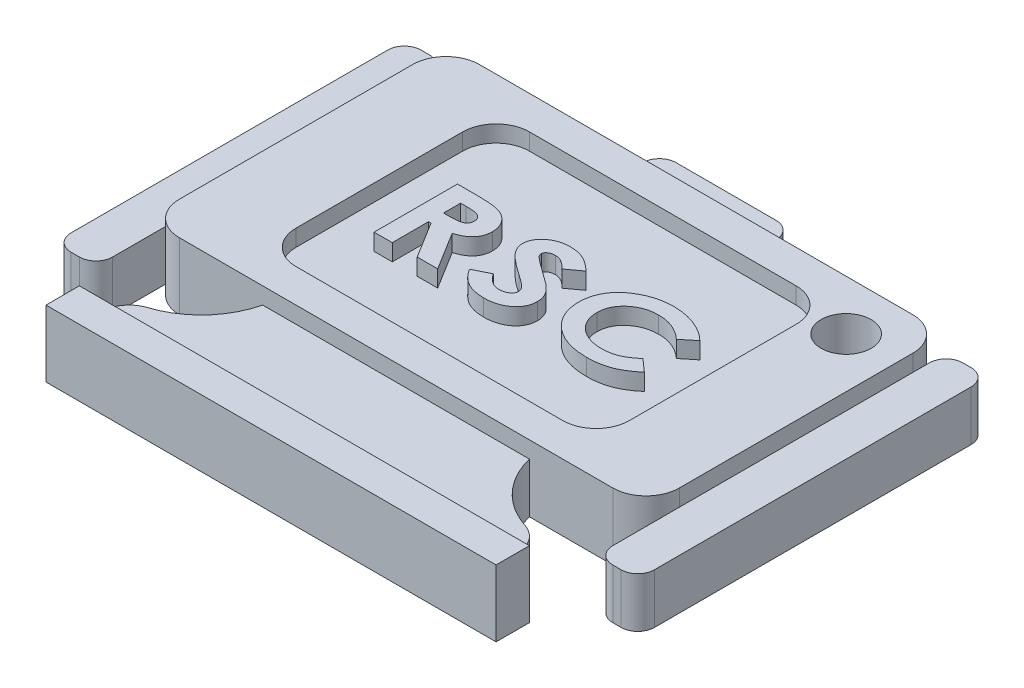
from build123d import *

# Parameters (mm, degrees)
ESTRUSIONE_ESTRUSIONE1_DEPTH = 3
ESTRUSIONE_ESTRUSIONE2_DEPTH = 4
ESTRUSIONE_ESTRUSIONE3_DEPTH = 3
RACCORDO1_R                  = 5
SCHIZZO3_R                   = 1.5
TAGLIO_ESTRUSIONE1_DEPTH     = 25.158579382
ESTRUSIONE_ESTRUSIONE4_DEPTH = 1


with BuildPart() as part:
    # Schizzo1 → Estrusione-Estrusione1 (new body)
    with BuildSketch(Plane(origin=(0, 0, 0), x_dir=(1, 0, 0), z_dir=(0, 1, 0))):
        with BuildLine():
            Line((-14.130087026, -5.671791426), (-14.130087026, 8.328208574))
            Line((-14.130087026, 8.328208574), (-14.130087026, 9.328208574))
            ThreePointArc((-14.130087026, 9.328208574), (-14.422980244, 10.035315355), (-15.130087026, 10.328208574))
            Line((-15.130087026, 10.328208574), (-15.630087026, 10.328208574))
            ThreePointArc((-15.630087026, 10.328208574), (-16.337193807, 10.035315355), (-16.630087026, 9.328208574))
            Line((-16.630087026, 9.328208574), (-16.630087026, -9.671791426))
            ThreePointArc((-16.630087026, -9.671791426), (-16.337193807, -10.378898207), (-15.630087026, -10.671791426))
            Line((-15.630087026, -10.671791426), (-15.130087026, -10.671791426))
            ThreePointArc((-15.130087026, -10.671791426), (-14.422980244, -10.378898207), (-14.130087026, -9.671791426))
            Line((-14.130087026, -9.671791426), (-14.130087026, -5.671791426))
        make_face()
        with BuildLine():
            Line((15.869912974, 9.328208574), (15.869912974, 8.328208574))
            Line((15.869912974, 8.328208574), (15.869912974, -5.671791426))
            Line((15.869912974, -5.671791426), (15.869912974, -9.671791426))
            ThreePointArc((15.869912974, -9.671791426), (16.162806193, -10.378898207), (16.869912974, -10.671791426))
            Line((16.869912974, -10.671791426), (17.369912974, -10.671791426))
            ThreePointArc((17.369912974, -10.671791426), (18.077019756, -10.378898207), (18.369912974, -9.671791426))
            Line((18.369912974, -9.671791426), (18.369912974, 9.328208574))
            ThreePointArc((18.369912974, 9.328208574), (18.077019756, 10.035315355), (17.369912974, 10.328208574))
            Line((17.369912974, 10.328208574), (16.869912974, 10.328208574))
            ThreePointArc((16.869912974, 10.328208574), (16.162806193, 10.035315355), (15.869912974, 9.328208574))
        make_face()
        with BuildLine():
            Line((-3.130087026, 11.128208574), (-3.130087026, 10.328208574))
            Line((-3.130087026, 10.328208574), (4.869912974, 10.328208574))
            Line((4.869912974, 10.328208574), (4.869912974, 11.128208574))
            ThreePointArc((4.869912974, 11.128208574), (4.577019756, 11.835315355), (3.869912974, 12.128208574))
            Line((3.869912974, 12.128208574), (-2.130087026, 12.128208574))
            ThreePointArc((-2.130087026, 12.128208574), (-2.837193807, 11.835315355), (-3.130087026, 11.128208574))
        make_face()
        Polygon((8.869912974, -7.671791426), (-7.130087026, -7.671791426), (-7.130087026, -11.171791426), (-7.130087026, -13.171791426), (8.869912974, -13.171791426), (8.869912974, -11.171791426), align=None)
        with BuildLine():
            Line((11.669912974, -11.171791426), (8.869912974, -11.171791426))
            Line((8.869912974, -11.171791426), (8.869912974, -13.171791426))
            Line((8.869912974, -13.171791426), (12.496589577, -13.171791426))
            Line((12.496589577, -13.171791426), (13.369912974, -13.171791426))
            Line((13.369912974, -13.171791426), (13.369912974, -12.871791426))
            ThreePointArc((13.369912974, -12.871791426), (12.871994503, -11.669709898), (11.669912974, -11.171791426))
        make_face()
        with BuildLine():
            Line((-7.130087026, -13.171791426), (-7.130087026, -11.171791426))
            Line((-7.130087026, -11.171791426), (-9.930087026, -11.171791426))
            ThreePointArc((-9.930087026, -11.171791426), (-11.132168554, -11.669709898), (-11.630087026, -12.871791426))
            Line((-11.630087026, -12.871791426), (-11.630087026, -13.171791426))
            Line((-11.630087026, -13.171791426), (-7.130087026, -13.171791426))
        make_face()
    extrude(amount=ESTRUSIONE_ESTRUSIONE1_DEPTH)

    # Schizzo1<3> → Estrusione-Estrusione2 (add)
    # profile 1 of 2: a face of its own
    with BuildSketch(Plane(origin=(0, 0, 0), x_dir=(1, 0, 0), z_dir=(0, 1, 0))):
        with BuildLine():
            ThreePointArc((13.869912974, 10.328208574), (15.284126537, 9.742422136), (15.869912974, 8.328208574))
            Line((15.869912974, 8.328208574), (15.869912974, -5.671791426))
            ThreePointArc((15.869912974, -5.671791426), (15.284126537, -7.086004989), (13.869912974, -7.671791426))
            Line((13.869912974, -7.671791426), (-12.130087026, -7.671791426))
            ThreePointArc((-12.130087026, -7.671791426), (-13.544300588, -7.086004989), (-14.130087026, -5.671791426))
            Line((-14.130087026, -5.671791426), (-14.130087026, 8.328208574))
            ThreePointArc((-14.130087026, 8.328208574), (-13.544300588, 9.742422136), (-12.130087026, 10.328208574))
            Line((-12.130087026, 10.328208574), (13.869912974, 10.328208574))
        make_face()
        with BuildLine():
            ThreePointArc((-7.130087026, 8.328208574), (-8.544300588, 7.742422136), (-9.130087026, 6.328208574))
            Line((-9.130087026, 6.328208574), (-9.130087026, -3.671791426))
            ThreePointArc((-9.130087026, -3.671791426), (-8.544300588, -5.086004989), (-7.130087026, -5.671791426))
            Line((-7.130087026, -5.671791426), (8.869912974, -5.671791426))
            ThreePointArc((8.869912974, -5.671791426), (10.284126537, -5.086004989), (10.869912974, -3.671791426))
            Line((10.869912974, -3.671791426), (10.869912974, 6.328208574))
            ThreePointArc((10.869912974, 6.328208574), (10.284126537, 7.742422136), (8.869912974, 8.328208574))
            Line((8.869912974, 8.328208574), (-7.130087026, 8.328208574))
        make_face(mode=Mode.SUBTRACT)
    # profile 2 of 2: a face of its own
    with BuildSketch(Plane(origin=(0, 0, 0), x_dir=(1, 0, 0), z_dir=(0, 1, 0))):
        Polygon((8.869912974, -13.171791426), (-7.130087026, -13.171791426), (-11.630087026, -13.171791426), (-12.630087026, -13.171791426), (-12.630087026, -15.171791426), (14.369912974, -15.171791426), (14.369912974, -13.171791426), (13.369912974, -13.171791426), (12.496589577, -13.171791426), align=None)
    extrude(amount=ESTRUSIONE_ESTRUSIONE2_DEPTH)

    # Schizzo1<4> → Estrusione-Estrusione3 (add)
    with BuildSketch(Plane(origin=(0, 0, 0), x_dir=(1, 0, 0), z_dir=(0, 1, 0))):
        with BuildLine():
            Line((-7.130087026, 8.328208574), (8.869912974, 8.328208574))
            ThreePointArc((8.869912974, 8.328208574), (10.284126537, 7.742422136), (10.869912974, 6.328208574))
            Line((10.869912974, 6.328208574), (10.869912974, -3.671791426))
            ThreePointArc((10.869912974, -3.671791426), (10.284126537, -5.086004989), (8.869912974, -5.671791426))
            Line((8.869912974, -5.671791426), (-7.130087026, -5.671791426))
            ThreePointArc((-7.130087026, -5.671791426), (-8.544300588, -5.086004989), (-9.130087026, -3.671791426))
            Line((-9.130087026, -3.671791426), (-9.130087026, 6.328208574))
            ThreePointArc((-9.130087026, 6.328208574), (-8.544300588, 7.742422136), (-7.130087026, 8.328208574))
        make_face()
    extrude(amount=ESTRUSIONE_ESTRUSIONE3_DEPTH)

    # Raccordo1
    # the kernel refuses this fillet: 5 mm, written as the material it adds along each edge
    with BuildSketch(Plane(origin=(-7.130087026, 0, 11.171791426), x_dir=(0, 0, -1), z_dir=(0, 1, 0))) as raccordo1_piece_1:
        with BuildLine():
            CenterArc((4.675499427, 4.859856078), RACCORDO1_R, 197.905093133, 58.497396124)
            Line((-0.082335966, 3.32265005), (-0.558119506, 3.168929447))
            ThreePointArc((-0.558119506, 3.168929447), (-0.5, 2.8), (-0.5, 0))
            Line((-0.5, 0), (0, -0.5))
            ThreePointArc((0, -0.5), (1.75, -0.5), (3.382450057, -0.485985608))
            Line((3.382450057, -0.485985608), (3.5, 0))
        make_face()
    extrude(amount=3)
    with BuildSketch(Plane(origin=(8.869912974, 0, 11.171791426), x_dir=(0.9996931119214204, 0, 0.02477260537098453), z_dir=(0, 1, 0))) as raccordo1_piece_2:
        with BuildLine():
            CenterArc((4.742540344, 4.794455868), RACCORDO1_R, 195.017021691, 58.497396124)
            Line((-0.086704119, 3.498925892), (-0.569628565, 3.369372894))
            ThreePointArc((-0.569628565, 3.369372894), (-0.543198615, 1.737076643), (-0.499846556, -0.012386303))
            Line((-0.499846556, -0.012386303), (0.012386303, -0.499846556))
            ThreePointArc((0.012386303, -0.499846556), (2.811527016, -0.430483261), (3.181783014, -0.479445587))
            Line((3.181783014, -0.479445587), (3.323670044, 0))
        make_face()
    extrude(amount=3)

    # Schizzo3 → Taglio-Estrusione1 (cut, through all)
    with BuildSketch(Plane(origin=(0, 4, 0), x_dir=(1, 0, 0), z_dir=(0, 1, 0))):
        with Locations(Location((12.869912974, 7.328208574, 0), (0, 0, 270))):
            Circle(SCHIZZO3_R)
    extrude(amount=-TAGLIO_ESTRUSIONE1_DEPTH, mode=Mode.SUBTRACT)

    # Schizzo5<2> → Estrusione-Estrusione4 (add)
    # profile 1 of 3: a face of its own
    with BuildSketch(Plane(origin=(0, 3, 0), x_dir=(1, 0, 0), z_dir=(0, 1, 0))):
        with BuildLine():
            Line((-6.57795792, 3.45884278), (-5.380041253, 3.45884278))
            add(Edge.make_bspline(
                [(-5.380041253, 3.45884278), (-5.300907615, 3.4585963), (-5.148615749, 3.45812195), (-4.928891966, 3.45068074), (-4.72678096, 3.440306849), (-4.542339431, 3.42455656), (-4.375954368, 3.403668126), (-4.227231565, 3.378737229), (-4.095774988, 3.35070869), (-3.980147563, 3.315823526), (-3.876063417, 3.276242807), (-3.779240114, 3.230565616), (-3.687144671, 3.180011491), (-3.600607712, 3.122431671), (-3.519207389, 3.05920745), (-3.442885979, 2.989871541), (-3.371577634, 2.914527715), (-3.30569568, 2.833471113), (-3.245636021, 2.748242685), (-3.194116551, 2.657832384), (-3.150296286, 2.564038636), (-3.113546133, 2.46646498), (-3.087103419, 2.364563098), (-3.066877995, 2.259567304), (-3.05449812, 2.150376702), (-3.053053538, 2.076329599), (-3.052316894, 2.038570344)],
                knots=[0, 0, 0, 0, 1.836570219, 3.53446034, 5.10207051, 6.533260598, 7.829841073, 8.992934726, 10.032625301, 10.947036066, 11.793235874, 12.614808957, 13.429924994, 14.229421483, 15.024587688, 15.82001815, 16.620302857, 17.429949247, 18.242519826, 19.037383916, 19.841635455, 20.64338194, 21.453510251, 22.281780062, 23.123818469, 24, 24, 24, 24], degree=3))
            add(Edge.make_bspline(
                [(-3.052316894, 2.038570344), (-3.05297922, 1.999135619), (-3.054279625, 1.921709871), (-3.067684349, 1.80812574), (-3.089409414, 1.699440448), (-3.121091841, 1.595815872), (-3.15944291, 1.496423898), (-3.208422514, 1.402487427), (-3.265167008, 1.313456609), (-3.331279077, 1.229630096), (-3.40505844, 1.150189602), (-3.489401592, 1.07713615), (-3.581193202, 1.007583117), (-3.683430759, 0.944839145), (-3.793364652, 0.885767849), (-3.912386463, 0.831394607), (-4.040283897, 0.782530341), (-4.12954515, 0.754700608), (-4.175113368, 0.740493421)],
                knots=[0, 0, 0, 0, 1.016086139, 1.994973482, 2.943504488, 3.869195015, 4.784910831, 5.685580803, 6.595129019, 7.502394393, 8.433946935, 9.385206858, 10.374891841, 11.399326033, 12.473554863, 13.590341435, 14.769859888, 16, 16, 16, 16], degree=3))
            Line((-4.175113368, 0.740493421), (-2.763855356, -1.54115722))
            Line((-2.763855356, -1.54115722), (-3.992821702, -1.54115722))
            Line((-3.992821702, -1.54115722), (-5.340978753, 0.63832996))
            Line((-5.340978753, 0.63832996), (-5.48821433, 0.63832996))
            Line((-5.48821433, 0.63832996), (-5.48821433, -1.54115722))
            Line((-5.48821433, -1.54115722), (-6.57795792, -1.54115722))
            Line((-6.57795792, -1.54115722), (-6.57795792, 3.45884278))
        make_face()
        with BuildLine():
            Line((-5.48821433, 1.535765857), (-5.121627791, 1.535765857))
            add(Edge.make_bspline(
                [(-5.121627791, 1.535765857), (-5.076887861, 1.536246519), (-4.991051342, 1.537168701), (-4.867369921, 1.541474985), (-4.754800733, 1.551691751), (-4.652940296, 1.564845862), (-4.561869264, 1.579563092), (-4.482176796, 1.601359931), (-4.412650319, 1.624482773), (-4.353432468, 1.65281106), (-4.303096944, 1.685676132), (-4.259467504, 1.722636435), (-4.223222155, 1.765571297), (-4.192352046, 1.812549575), (-4.171015601, 1.866010442), (-4.153567342, 1.92279566), (-4.143376079, 1.985126246), (-4.142510771, 2.028183496), (-4.142060484, 2.050589575)],
                knots=[0, 0, 0, 0, 1.708363675, 3.277608857, 4.723712974, 6.021838054, 7.199660436, 8.241690857, 9.172961181, 9.993967569, 10.739999558, 11.46313589, 12.168296226, 12.87908003, 13.598837728, 14.357076655, 15.145057537, 16, 16, 16, 16], degree=3))
            add(Edge.make_bspline(
                [(-4.142060484, 2.050589575), (-4.14298007, 2.077115511), (-4.144789383, 2.129306109), (-4.166122877, 2.204069719), (-4.198271815, 2.27415755), (-4.245147028, 2.336554135), (-4.301469022, 2.393342609), (-4.368002042, 2.441229248), (-4.443138046, 2.480710007), (-4.512931795, 2.505839283), (-4.576764667, 2.521497239), (-4.634249483, 2.532362095), (-4.701174464, 2.541014101), (-4.776617032, 2.549126326), (-4.861476575, 2.554982161), (-4.955327031, 2.558906433), (-5.058520965, 2.56060477), (-5.130308089, 2.561132166), (-5.167701509, 2.561406883)],
                knots=[0, 0, 0, 0, 0.985252127, 1.938513972, 2.873098658, 3.843165384, 4.828025027, 5.842890392, 6.883115312, 7.980634618, 8.595920604, 9.330050158, 10.158404267, 11.108741491, 12.156004298, 13.326020887, 14.60714262, 16, 16, 16, 16], degree=3))
            Line((-5.167701509, 2.561406883), (-5.48821433, 2.561406883))
            Line((-5.48821433, 2.561406883), (-5.48821433, 1.535765857))
        make_face(mode=Mode.SUBTRACT)
    # profile 2 of 3: a face of its own
    with BuildSketch(Plane(origin=(0, 3, 0), x_dir=(1, 0, 0), z_dir=(0, 1, 0))):
        with BuildLine():
            Line((1.800247208, 2.79077387), (0.961905862, 2.176791498))
            add(Edge.make_bspline(
                [(0.961905862, 2.176791498), (0.925807739, 2.21745224), (0.855979704, 2.296106183), (0.744339504, 2.400610147), (0.632167642, 2.489248509), (0.519648775, 2.562066791), (0.406680342, 2.619209113), (0.292639308, 2.659590175), (0.177758494, 2.6848713), (0.100650248, 2.688041934), (0.06246676, 2.689612011)],
                knots=[0, 0, 0, 0, 1.221275186, 2.362428825, 3.431016632, 4.429913078, 5.369341348, 6.268639847, 7.142642039, 8, 8, 8, 8], degree=3))
            add(Edge.make_bspline(
                [(0.06246676, 2.689612011), (0.026985712, 2.688636631), (-0.041200076, 2.686762192), (-0.138588381, 2.66753561), (-0.225867569, 2.635400344), (-0.301632893, 2.591765636), (-0.363026952, 2.54056692), (-0.409944572, 2.485573459), (-0.437567069, 2.424852334), (-0.441446231, 2.382695882), (-0.443342535, 2.362087972)],
                knots=[0, 0, 0, 0, 1.286278489, 2.47190871, 3.583616279, 4.64755846, 5.62792584, 6.471833469, 7.252965648, 8, 8, 8, 8], degree=3))
            add(Edge.make_bspline(
                [(-0.443342535, 2.362087972), (-0.442352652, 2.341199429), (-0.440342608, 2.298783386), (-0.418133872, 2.237582358), (-0.387533192, 2.176537891), (-0.357066073, 2.141155181), (-0.341179074, 2.12270496)],
                knots=[0, 0, 0, 0, 0.937548871, 1.903776294, 2.906929648, 4, 4, 4, 4], degree=3))
            add(Edge.make_bspline(
                [(-0.341179074, 2.12270496), (-0.327030817, 2.10812693), (-0.294081772, 2.07417701), (-0.231500615, 2.021915949), (-0.153240369, 1.956837659), (-0.056418172, 1.882175532), (0.056471208, 1.795529893), (0.188436752, 1.700164682), (0.336031221, 1.591311008), (0.441591934, 1.516864036), (0.497162273, 1.477672908)],
                knots=[0, 0, 0, 0, 0.460236507, 1.071817812, 1.846079868, 2.768076201, 3.842799649, 5.071965004, 6.458594214, 8, 8, 8, 8], degree=3))
            add(Edge.make_bspline(
                [(0.497162273, 1.477672908), (0.548897173, 1.441261201), (0.647066148, 1.372168579), (0.786750227, 1.274323553), (0.909538973, 1.185480169), (1.01795463, 1.109733538), (1.108024863, 1.04148567), (1.183498301, 0.985974723), (1.242487767, 0.940062124), (1.276117178, 0.912487109), (1.290431503, 0.900749831)],
                knots=[0, 0, 0, 0, 1.547641866, 2.936710292, 4.171942255, 5.255262621, 6.171657329, 6.936133225, 7.547166146, 8, 8, 8, 8], degree=3))
            add(Edge.make_bspline(
                [(1.290431503, 0.900749831), (1.344946547, 0.853156585), (1.448932284, 0.762373958), (1.585445343, 0.620092714), (1.697597818, 0.481389165), (1.784827352, 0.343342219), (1.848683762, 0.203096836), (1.896063109, 0.059303322), (1.923251707, -0.091475079), (1.926708119, -0.1942311), (1.928452337, -0.246085104)],
                knots=[0, 0, 0, 0, 1.276526583, 2.43493443, 3.474657694, 4.419532982, 5.307929191, 6.18733263, 7.085269538, 8, 8, 8, 8], degree=3))
            add(Edge.make_bspline(
                [(1.928452337, -0.246085104), (1.92685608, -0.296577067), (1.923720429, -0.395762344), (1.900609327, -0.541585526), (1.859920599, -0.679633921), (1.805926857, -0.812095183), (1.733540006, -0.936354763), (1.647619471, -1.055432582), (1.543760826, -1.166003256), (1.426439323, -1.26937767), (1.296324119, -1.363333691), (1.155657925, -1.445927375), (1.005107218, -1.514706248), (0.845219335, -1.571302526), (0.675879622, -1.614867437), (0.496829351, -1.647017851), (0.308284401, -1.666284189), (0.179365857, -1.668321984), (0.113548491, -1.669362348)],
                knots=[0, 0, 0, 0, 0.939700259, 1.845926089, 2.73882166, 3.613627635, 4.501600527, 5.408997537, 6.341250136, 7.318720483, 8.315672525, 9.323949117, 10.350013553, 11.391747708, 12.477003977, 13.600911914, 14.775182716, 16, 16, 16, 16], degree=3))
            add(Edge.make_bspline(
                [(0.113548491, -1.669362348), (0.061775138, -1.668616833), (-0.040244804, -1.667147788), (-0.19072861, -1.654810398), (-0.336225828, -1.634961078), (-0.476745108, -1.606951438), (-0.612242925, -1.57085849), (-0.742559745, -1.527052826), (-0.867491391, -1.474324754), (-0.988092151, -1.414596853), (-1.10366461, -1.34483495), (-1.215061673, -1.266860227), (-1.321448499, -1.179025123), (-1.424196558, -1.082668998), (-1.521747009, -0.976201949), (-1.616551878, -0.861595047), (-1.706806363, -0.737635896), (-1.761661296, -0.64942152), (-1.789496381, -0.604658822)],
                knots=[0, 0, 0, 0, 1.083130667, 2.134320523, 3.156824495, 4.154178402, 5.130191439, 6.088927205, 7.028226078, 7.965444552, 8.902298482, 9.850002013, 10.807948518, 11.786433331, 12.794881184, 13.827051463, 14.897378851, 16, 16, 16, 16], degree=3))
            Line((-1.789496381, -0.604658822), (-0.837973945, -0.13090081))
            add(Edge.make_bspline(
                [(-0.837973945, -0.13090081), (-0.802555305, -0.181727913), (-0.734108899, -0.27995112), (-0.619201778, -0.410075207), (-0.501922129, -0.521718959), (-0.379933284, -0.613257594), (-0.253144137, -0.683882501), (-0.122210767, -0.734935995), (0.012925919, -0.766134214), (0.104708558, -0.769995483), (0.150607785, -0.771926451)],
                knots=[0, 0, 0, 0, 1.209050236, 2.336485557, 3.383619759, 4.366928439, 5.306794706, 6.208921133, 7.104306266, 8, 8, 8, 8], degree=3))
            add(Edge.make_bspline(
                [(0.150607785, -0.771926451), (0.197504269, -0.770366074), (0.288130784, -0.767350679), (0.417698462, -0.739367222), (0.536499208, -0.695672905), (0.639764055, -0.63259592), (0.727260454, -0.560402889), (0.791296704, -0.479065482), (0.832095702, -0.390836246), (0.836511707, -0.328955291), (0.838708747, -0.298168438)],
                knots=[0, 0, 0, 0, 1.223176065, 2.363763199, 3.44547837, 4.513116674, 5.508951787, 6.39142225, 7.199704549, 8, 8, 8, 8], degree=3))
            add(Edge.make_bspline(
                [(0.838708747, -0.298168438), (0.837069284, -0.269535893), (0.833707194, -0.210818402), (0.801711284, -0.124541088), (0.753987692, -0.038332749), (0.69848087, 0.031938169), (0.641895898, 0.090984635), (0.586465093, 0.141468773), (0.520528222, 0.198896056), (0.441934553, 0.260415231), (0.35278894, 0.328524929), (0.252720539, 0.402936909), (0.140272195, 0.481581701), (0.061498187, 0.535881537), (0.020399452, 0.56421137)],
                knots=[0, 0, 0, 0, 0.835873241, 1.714146576, 2.663982354, 3.716364857, 4.325032755, 5.058533319, 5.911339222, 6.885726203, 7.981033349, 9.197583309, 10.53789618, 12, 12, 12, 12], degree=3))
            add(Edge.make_bspline(
                [(0.020399452, 0.56421137), (-0.057913726, 0.618028554), (-0.208006337, 0.721172903), (-0.420772467, 0.873701738), (-0.612221849, 1.01640403), (-0.781518778, 1.150411147), (-0.929062897, 1.274772481), (-1.056010924, 1.388345723), (-1.160524864, 1.493213609), (-1.245405367, 1.590511283), (-1.313372969, 1.683848764), (-1.372498845, 1.774297342), (-1.421315755, 1.865301088), (-1.461816659, 1.956347472), (-1.49438462, 2.046870519), (-1.515895902, 2.137999962), (-1.531297495, 2.22835075), (-1.532492098, 2.288906988), (-1.533086125, 2.319019062)],
                knots=[0, 0, 0, 0, 1.875904638, 3.595300711, 5.167975192, 6.589564332, 7.857160913, 8.977131668, 9.95123383, 10.778403762, 11.523244971, 12.228971327, 12.910202534, 13.559366066, 14.195174723, 14.805853887, 15.406201266, 16, 16, 16, 16], degree=3))
            add(Edge.make_bspline(
                [(-1.533086125, 2.319019062), (-1.53185705, 2.361852548), (-1.529429959, 2.446437157), (-1.506464817, 2.570943168), (-1.469305248, 2.69058065), (-1.417730332, 2.805504445), (-1.351974041, 2.916088162), (-1.270184765, 3.020956914), (-1.174445419, 3.121448274), (-1.065713556, 3.215875598), (-0.946228482, 3.302618571), (-0.818111625, 3.378664605), (-0.68288733, 3.443007781), (-0.54129394, 3.496436704), (-0.392717876, 3.537297488), (-0.237294205, 3.566451401), (-0.075132523, 3.583429301), (0.03538395, 3.585829096), (0.091513234, 3.587047908)],
                knots=[0, 0, 0, 0, 0.898727369, 1.774744743, 2.648430524, 3.523998918, 4.413739474, 5.343461403, 6.310473423, 7.324163075, 8.363304562, 9.406953458, 10.44805606, 11.504111669, 12.580793738, 13.679438261, 14.821429358, 16, 16, 16, 16], degree=3))
            add(Edge.make_bspline(
                [(0.091513234, 3.587047908), (0.164415452, 3.584891823), (0.30925566, 3.58060817), (0.523356491, 3.547408173), (0.732243455, 3.494434108), (0.90171002, 3.431270452), (1.036319864, 3.368946495), (1.139618819, 3.312606406), (1.244589058, 3.246747802), (1.353249154, 3.174377259), (1.461832877, 3.090406648), (1.573427014, 2.998942981), (1.687616807, 2.899362346), (1.762158515, 2.827495688), (1.800247208, 2.79077387)],
                knots=[0, 0, 0, 0, 1.35300284, 2.68811045, 4.012599843, 5.34822536, 6.038744838, 6.765456977, 7.530921319, 8.338946828, 9.188170671, 10.077873014, 11.017847775, 12, 12, 12, 12], degree=3))
        make_face()
    # profile 3 of 3: a face of its own
    with BuildSketch(Plane(origin=(0, 3, 0), x_dir=(1, 0, 0), z_dir=(0, 1, 0))):
        with BuildLine():
            Line((8.832298491, 2.59145496), (8.054053298, 1.962448549))
            add(Edge.make_bspline(
                [(8.054053298, 1.962448549), (7.987897421, 2.020371075), (7.857588706, 2.134462373), (7.648767795, 2.282944552), (7.433091024, 2.407049231), (7.21300534, 2.512447146), (6.984763043, 2.59070013), (6.751278439, 2.648424995), (6.511325203, 2.683641441), (6.349109096, 2.687608668), (6.267194324, 2.689612011)],
                knots=[0, 0, 0, 0, 1.067527142, 2.102732167, 3.10569656, 4.087098218, 5.061774412, 6.030552988, 7.005482224, 8, 8, 8, 8], degree=3))
            add(Edge.make_bspline(
                [(6.267194324, 2.689612011), (6.198689418, 2.688031275), (6.063956228, 2.684922336), (5.865847969, 2.661624347), (5.67623463, 2.622561165), (5.494628486, 2.568585454), (5.321837671, 2.49791211), (5.156555585, 2.412642592), (5.000086199, 2.311081916), (4.853808998, 2.195461455), (4.720027142, 2.069083711), (4.602072435, 1.934104297), (4.503501956, 1.790489264), (4.421214541, 1.641002915), (4.359032278, 1.482913222), (4.313855445, 1.318116056), (4.286005393, 1.145748864), (4.282695467, 1.028390993), (4.281016439, 0.968858806)],
                knots=[0, 0, 0, 0, 1.123147555, 2.20896959, 3.265468395, 4.294285714, 5.31091199, 6.322173291, 7.339580517, 8.36473528, 9.375462965, 10.353472599, 11.298027794, 12.226485346, 13.145501207, 14.076521539, 15.024276102, 16, 16, 16, 16], degree=3))
            add(Edge.make_bspline(
                [(4.281016439, 0.968858806), (4.281756382, 0.92709435), (4.283215735, 0.84472436), (4.295704572, 0.722924437), (4.315378996, 0.604703108), (4.343870896, 0.490429909), (4.378459587, 0.379195277), (4.423373027, 0.272299203), (4.47380227, 0.167466308), (4.534214341, 0.067751987), (4.601473849, -0.027368751), (4.674664938, -0.118117386), (4.755141155, -0.202996048), (4.841170021, -0.283712649), (4.934999004, -0.357849478), (5.035193396, -0.426862353), (5.141659906, -0.490856795), (5.253515715, -0.550519968), (5.371364006, -0.601246182), (5.491747602, -0.648478251), (5.616475885, -0.686241065), (5.744395083, -0.716670869), (5.875181656, -0.742767268), (6.009496085, -0.758644601), (6.146779083, -0.770830348), (6.239454387, -0.771558816), (6.286224773, -0.771926451)],
                knots=[0, 0, 0, 0, 1.01124304, 1.994425115, 2.962157876, 3.911336384, 4.844712957, 5.780188581, 6.716781774, 7.659740626, 8.599713336, 9.536725274, 10.480550418, 11.430279814, 12.391266821, 13.373650588, 14.374854857, 15.398436071, 16.441097469, 17.480241446, 18.528905263, 19.593809216, 20.664224499, 21.756407018, 22.867727367, 24, 24, 24, 24], degree=3))
            add(Edge.make_bspline(
                [(6.286224773, -0.771926451), (6.365439437, -0.769992768), (6.520743786, -0.766201686), (6.748513235, -0.736687785), (6.965450966, -0.687642898), (7.139334767, -0.630457608), (7.275338703, -0.572899933), (7.378991707, -0.520113776), (7.486362093, -0.461433094), (7.595481156, -0.393964713), (7.707175428, -0.318570356), (7.820588268, -0.234362834), (7.937356984, -0.143091355), (8.014527937, -0.078067076), (8.054053298, -0.044762989)],
                knots=[0, 0, 0, 0, 1.454897132, 2.85239928, 4.210863431, 5.535567464, 6.208840487, 6.921998941, 7.671422934, 8.456156138, 9.277796038, 10.146309466, 11.050578152, 12, 12, 12, 12], degree=3))
            Line((8.054053298, -0.044762989), (8.808260029, -0.714835104))
            add(Edge.make_bspline(
                [(8.808260029, -0.714835104), (8.755129778, -0.758266833), (8.650866448, -0.843497688), (8.492871734, -0.962495012), (8.336866816, -1.070920783), (8.184148221, -1.170483919), (8.032828436, -1.258955353), (7.882941213, -1.335870097), (7.736380038, -1.404533225), (7.59002375, -1.462148463), (7.442630109, -1.511774443), (7.291000877, -1.553469277), (7.135044609, -1.58976583), (6.973526369, -1.618649166), (6.807160914, -1.641796944), (6.635343295, -1.657314083), (6.458969949, -1.66798478), (6.339660046, -1.668899115), (6.279213555, -1.669362348)],
                knots=[0, 0, 0, 0, 1.189352786, 2.333997676, 3.427225781, 4.481802152, 5.493180527, 6.463754106, 7.401030282, 8.297247864, 9.188444371, 10.095433293, 11.021910727, 11.962895372, 12.938424752, 13.932301483, 14.952432975, 16, 16, 16, 16], degree=3))
            add(Edge.make_bspline(
                [(6.279213555, -1.669362348), (6.168619103, -1.666965008), (5.951902362, -1.66226727), (5.634261788, -1.628060518), (5.332026196, -1.570248533), (5.04505532, -1.488988956), (4.773564516, -1.384896384), (4.517686383, -1.256972912), (4.27712326, -1.106106421), (4.090363181, -0.9615906), (3.950491807, -0.836857548), (3.852677831, -0.739040835), (3.762185874, -0.637784912), (3.676018623, -0.535075737), (3.599025208, -0.426990639), (3.528195264, -0.316322665), (3.463333015, -0.202628128), (3.406708979, -0.085150025), (3.355237981, 0.034939944), (3.311244709, 0.158405536), (3.273860899, 0.285088204), (3.244327428, 0.415352491), (3.219903172, 0.548612803), (3.203111533, 0.685055406), (3.192715215, 0.824796973), (3.191757788, 0.919093978), (3.19127285, 0.966855601)],
                knots=[0, 0, 0, 0, 1.750181118, 3.429589313, 5.049357415, 6.614963186, 8.143845363, 9.644423126, 11.135443565, 12.630988945, 13.375670058, 14.100534031, 14.818897545, 15.524555374, 16.221133255, 16.91739039, 17.603609734, 18.29131262, 18.980293258, 19.670569505, 20.364476687, 21.069461537, 21.783595391, 22.50782351, 23.244209602, 24, 24, 24, 24], degree=3))
            add(Edge.make_bspline(
                [(3.19127285, 0.966855601), (3.19230057, 1.028342162), (3.194338716, 1.150280654), (3.214401924, 1.329901561), (3.243986807, 1.504778035), (3.286771454, 1.674101227), (3.344060952, 1.837859426), (3.409936655, 1.997482369), (3.491601096, 2.150391114), (3.583286041, 2.298762617), (3.687376835, 2.440535251), (3.802498696, 2.575446575), (3.927385166, 2.703953674), (4.064357488, 2.823917903), (4.210954227, 2.937676345), (4.36852854, 3.043535811), (4.536289736, 3.143063038), (4.713656203, 3.234435047), (4.898076195, 3.317395479), (5.087438682, 3.389436902), (5.280059654, 3.450544838), (5.475846888, 3.501275748), (5.675775339, 3.538577341), (5.87888591, 3.567259156), (6.085986605, 3.583088057), (6.225102708, 3.58572066), (6.295239196, 3.587047908)],
                knots=[0, 0, 0, 0, 0.977774021, 1.939095111, 2.871639716, 3.797825489, 4.713212348, 5.629600177, 6.541884779, 7.467430742, 8.402256353, 9.336659416, 10.286883314, 11.250183051, 12.230737116, 13.236849212, 14.267954381, 15.332150946, 16.409074216, 17.483256768, 18.553229402, 19.622410832, 20.698430043, 21.786804513, 22.884199939, 24, 24, 24, 24], degree=3))
            add(Edge.make_bspline(
                [(6.295239196, 3.587047908), (6.355023394, 3.586296423), (6.474044728, 3.584800329), (6.651821817, 3.572166304), (6.828100182, 3.552791208), (7.002320261, 3.522896607), (7.175413235, 3.48754354), (7.346173284, 3.441702895), (7.516073202, 3.390341458), (7.682755607, 3.328620568), (7.846593743, 3.26141053), (8.004676225, 3.185801067), (8.157824898, 3.105174651), (8.30374076, 3.015172641), (8.44543544, 2.920518467), (8.580679022, 2.817978481), (8.710468373, 2.709047056), (8.791673521, 2.630666736), (8.832298491, 2.59145496)],
                knots=[0, 0, 0, 0, 1.026787777, 2.044179787, 3.060002783, 4.071624424, 5.079386237, 6.093427, 7.107451547, 8.127055474, 9.145206858, 10.148209072, 11.135946312, 12.116532237, 13.091551623, 14.061888063, 15.030409504, 16, 16, 16, 16], degree=3))
        make_face()
    extrude(amount=ESTRUSIONE_ESTRUSIONE4_DEPTH)


solid = part.part
